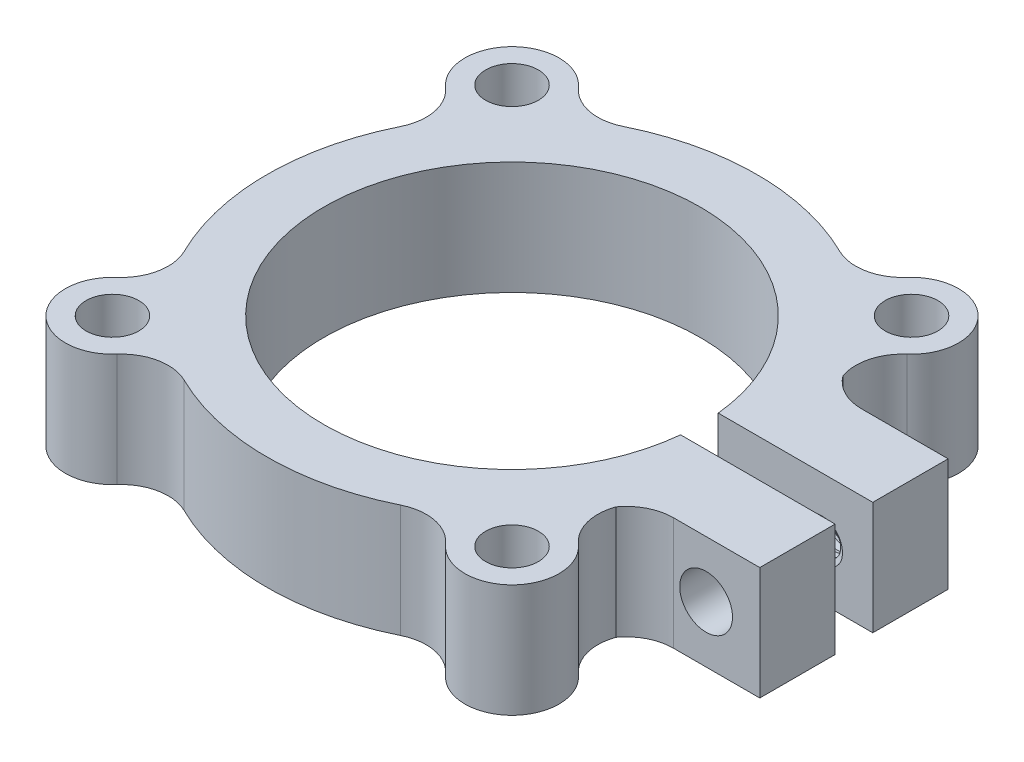
from build123d import *

# Parameters (mm, degrees)
BOSS_EXTRUDE1_DEPTH           = 7.62
CUT_EXTRUDE1_DEPTH            = 30.441514138
SKETCH3_W                     = 12.7
SKETCH3_H                     = 7.62
F_6_CLEARANCE_HOLE1_D         = 3.556
TAP_DRILL_FOR_5_40_TAP1_D     = 2.5781
TAP_DRILL_FOR_5_40_TAP1_DEPTH = 5.08
F_5_CLEARANCE_HOLE2_D         = 3.556
F_5_CLEARANCE_HOLE2_DEPTH     = 5.08
THREAD2_PITCH                 = 0.635


with BuildPart() as part:
    # Sketch1 → Boss-Extrude1 (new body)
    with BuildSketch(Plane(origin=(0, 7.62, 0), x_dir=(1, 0, 0), z_dir=(0, 1, 0))):
        with BuildLine():
            Line((23.057960451, -6.35), (23.057960451, 6.35))
            Line((23.057960451, 6.35), (17.227118157, 6.35))
            ThreePointArc((17.227118157, 6.35), (15.786457002, 6.695667846), (14.659490486, 7.657404449))
            ThreePointArc((14.659490486, 7.657404449), (14.589471792, 9.508848608), (15.564771332, 11.084138707))
            ThreePointArc((15.564771332, 11.084138707), (15.715448212, 15.715448212), (11.084138707, 15.564771332))
            ThreePointArc((11.084138707, 15.564771332), (9.317430783, 14.545190239), (7.295007228, 14.810907114))
            ThreePointArc((7.295007228, 14.810907114), (0, 16.51), (-7.295007228, 14.810907114))
            ThreePointArc((-7.295007228, 14.810907114), (-9.317430783, 14.545190239), (-11.084138707, 15.564771332))
            ThreePointArc((-11.084138707, 15.564771332), (-15.715448212, 15.715448212), (-15.564771332, 11.084138707))
            ThreePointArc((-15.564771332, 11.084138707), (-14.545190239, 9.317430783), (-14.810907114, 7.295007228))
            ThreePointArc((-14.810907114, 7.295007228), (-16.51, 0), (-14.810907114, -7.295007228))
            ThreePointArc((-14.810907114, -7.295007228), (-14.545190239, -9.317430783), (-15.564771332, -11.084138707))
            ThreePointArc((-15.564771332, -11.084138707), (-15.715448212, -15.715448212), (-11.084138707, -15.564771332))
            ThreePointArc((-11.084138707, -15.564771332), (-9.317430783, -14.545190239), (-7.295007228, -14.810907114))
            ThreePointArc((-7.295007228, -14.810907114), (0, -16.51), (7.295007228, -14.810907114))
            ThreePointArc((7.295007228, -14.810907114), (9.317430783, -14.545190239), (11.084138707, -15.564771332))
            ThreePointArc((11.084138707, -15.564771332), (15.715448212, -15.715448212), (15.564771332, -11.084138707))
            ThreePointArc((15.564771332, -11.084138707), (14.589471792, -9.508848608), (14.659490486, -7.657404449))
            ThreePointArc((14.659490486, -7.657404449), (15.786457002, -6.695667846), (17.227118157, -6.35))
            Line((17.227118157, -6.35), (23.057960451, -6.35))
        make_face()
    extrude(amount=-BOSS_EXTRUDE1_DEPTH)

    # Sketch2 → Cut-Extrude1 (cut, through all)
    with BuildSketch(Plane.XZ):
        with BuildLine():
            Line((23.057960451, -1.27), (23.057960451, 1.27))
            Line((23.057960451, 1.27), (12.636340451, 1.27))
            ThreePointArc((12.636340451, 1.27), (12.7, 0), (12.636340451, -1.27))
            Line((12.636340451, -1.27), (23.057960451, -1.27))
        make_face()
    extrude(amount=-CUT_EXTRUDE1_DEPTH, mode=Mode.SUBTRACT)

    # Sketch3 → Cut-Revolve1 (revolve, cut)
    with BuildSketch(Plane.XY):
        with Locations((6.35, 3.81)):
            Rectangle(SKETCH3_W, SKETCH3_H)
    revolve(axis=Axis((0, 7.62, 0), (0, -1, 0)), mode=Mode.SUBTRACT)

    # #6 Clearance Hole1 (through all)
    with Locations(Plane(origin=(0, 7.62, 0), x_dir=(1, 0, 0), z_dir=(0, 1, 0))):
        with Locations((13.470384182, -13.470384182), (-13.470384182, -13.470384182), (-13.470384182, 13.470384182), (13.470384182, 13.470384182)):
            Hole(F_6_CLEARANCE_HOLE1_D / 2)

    # Tap Drill for #5-40 Tap1
    with Locations(Plane(origin=(0, 0, -6.35), x_dir=(-1, 0, 0), z_dir=(0, 0, -1))):
        with Locations((-19.438793191, 3.81)):
            Hole(TAP_DRILL_FOR_5_40_TAP1_D / 2, depth=TAP_DRILL_FOR_5_40_TAP1_DEPTH)

    # #5 Clearance Hole2
    with Locations(Plane.XY.offset(6.35)):
        with Locations((19.438793191, 3.81)):
            Hole(F_5_CLEARANCE_HOLE2_D / 2, depth=F_5_CLEARANCE_HOLE2_DEPTH)

    # Thread2: the profile of Thread Profile2 profile screwed along a right-hand helix of 10 turns, 6 arcs to a turn; built about Z, then put on its axis
    thread2_z = Axis((0, 0, 0), (0, 0, 1))
    thread2_corners = [(1.28875, 0, -0.000173205), (1.63275383, 0, 0.198437499), (1.63275383, 0, 0.277812499), (1.28875, 0, 0.476423203)]
    with BuildLine(mode=Mode.PRIVATE) as thread2_profile:
        Line(thread2_corners[0], thread2_corners[1])
        Line(thread2_corners[1], thread2_corners[2])
        Line(thread2_corners[2], thread2_corners[3])
        Line(thread2_corners[3], thread2_corners[0])
    thread2_cap = Face(thread2_profile.wire())
    thread2_turn_angles = [0, 30, 60, 90, 120, 150, 180, 210, 240, 270, 300, 330, 360]
    thread2_turn_weights = [1, 0.8660254037844387, 1, 0.8660254037844387, 1, 0.8660254037844387, 1, 0.8660254037844387, 1, 0.8660254037844387, 1, 0.8660254037844387, 1]
    thread2_turn_rails = [Edge.make_bspline([Vector(p[0], p[1], 0).rotate(thread2_z, thread2_turn_angles[k]) / thread2_turn_weights[k] + Vector(0, 0, p[2] + THREAD2_PITCH * thread2_turn_angles[k] / 360) for k in range(13)], [0, 0, 0, 1, 1, 2, 2, 3, 3, 4, 4, 5, 5, 6, 6, 6], 2, thread2_turn_weights) for p in thread2_corners]
    thread2_turn_sides = [Face.make_surface_from_curves(thread2_turn_rails[p[0]], thread2_turn_rails[p[1]]) for p in [(0, 1), (1, 2), (2, 3), (3, 0)]]
    thread2 = Plane(origin=(19.438793191, 3.81, 0), x_dir=(-1, 0, 0), z_dir=(0, 0, -1)) * Solid(Shell([*[p.moved(Location((0, 0, THREAD2_PITCH * i))) for i in range(10) for p in thread2_turn_sides], thread2_cap, thread2_cap.rotate(thread2_z, 3600).moved(Location((0, 0, THREAD2_PITCH * 3600 / 360)))]))
    add(thread2, mode=Mode.SUBTRACT)


solid = part.part
